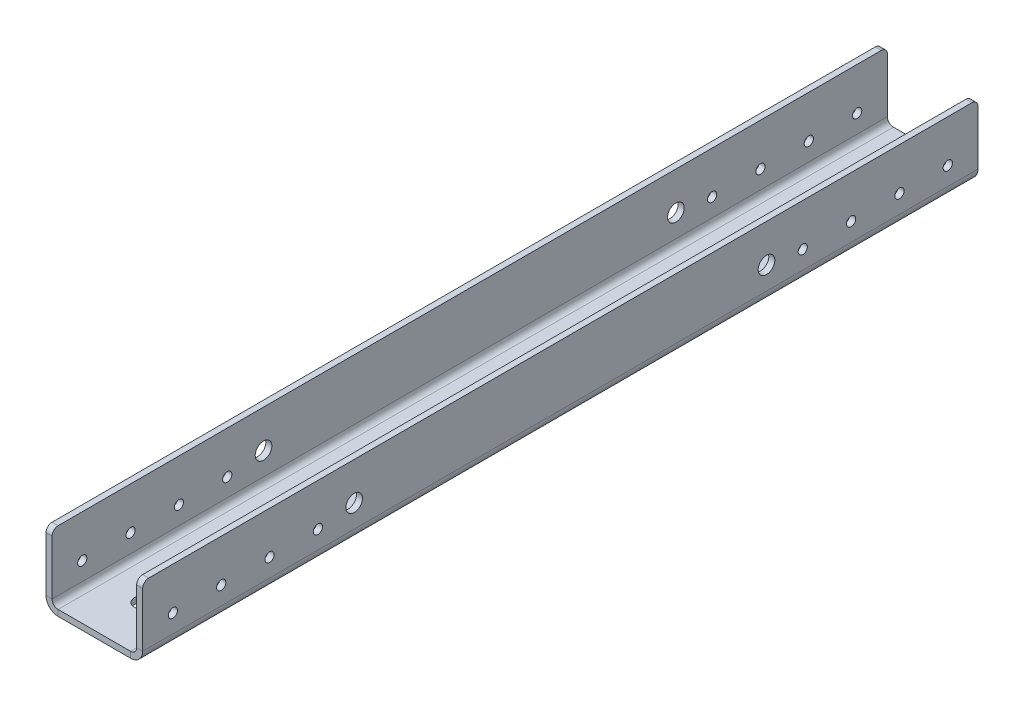
from build123d import *

# Parameters (mm, degrees)
BASE_FLANGE1_DEPTH = 438.912
SKETCH6_R          = 2.4257
CUT_EXTRUDE1_DEPTH = 444.481672388
SKETCH7_R          = 4.3688
CUT_EXTRUDE2_DEPTH = 444.481672388
SKETCH8_R          = 4.3688
CUT_EXTRUDE3_DEPTH = 444.481672388
FILLET1_R          = 3.175


# Sheet-metal steps are written as plain solids
with BuildPart() as part:
    # Sketch1 → Base-Flange1 (new body)
    with BuildSketch(Plane.XY):
        with BuildLine():
            Line((50.8, 38.1), (50.8, 6.35))
            ThreePointArc((50.8, 6.35), (48.940128061, 1.859871939), (44.45, 0))
            Line((44.45, 0), (6.35, 0))
            ThreePointArc((6.35, 0), (1.859871939, 1.859871939), (0, 6.35))
            Line((0, 6.35), (0, 38.1))
            Line((0, 38.1), (3.175, 38.1))
            Line((3.175, 38.1), (3.175, 6.35))
            ThreePointArc((3.175, 6.35), (4.10493597, 4.10493597), (6.35, 3.175))
            Line((6.35, 3.175), (44.45, 3.175))
            ThreePointArc((44.45, 3.175), (46.69506403, 4.10493597), (47.625, 6.35))
            Line((47.625, 6.35), (47.625, 38.1))
            Line((47.625, 38.1), (50.8, 38.1))
        make_face()
    extrude(amount=BASE_FLANGE1_DEPTH)

    # Sketch6 → Cut-Extrude1 (cut, through all)
    with BuildSketch(Plane(origin=(50.8, 0, 0), x_dir=(0, 0, -1), z_dir=(1, 0, 0))):
        with Locations((-15.875, 15.875)):
            Circle(SKETCH6_R)
        with Locations((-41.275, 15.875)):
            Circle(SKETCH6_R)
        with Locations((-66.675, 15.875)):
            Circle(SKETCH6_R)
        with Locations((-372.237, 15.875)):
            Circle(SKETCH6_R)
        with Locations((-397.637, 15.875)):
            Circle(SKETCH6_R)
        with Locations((-423.037, 15.875)):
            Circle(SKETCH6_R)
        with Locations((-92.075, 15.875)):
            Circle(SKETCH6_R)
        with Locations((-346.837, 15.875)):
            Circle(SKETCH6_R)
    extrude(amount=-CUT_EXTRUDE1_DEPTH, mode=Mode.SUBTRACT)

    # Sketch7 → Cut-Extrude2 (cut, through all)
    with BuildSketch(Plane.XZ):
        with Locations(Location((25.4, 219.456, 0), (0, 0, 270))):
            Circle(SKETCH7_R)
        with Locations(Location((25.4, 25.4, 0), (0, 0, 270))):
            Circle(SKETCH7_R)
        with Locations(Location((25.4, 413.512, 0), (0, 0, 270))):
            Circle(SKETCH7_R)
    extrude(amount=-CUT_EXTRUDE2_DEPTH, mode=Mode.SUBTRACT)

    # Sketch8 → Cut-Extrude3 (cut, through all)
    with BuildSketch(Plane(origin=(50.8, 0, 0), x_dir=(0, 0, -1), z_dir=(1, 0, 0))):
        with Locations((-111.125, 18.288)):
            Circle(SKETCH8_R)
        with Locations((-327.787, 18.288)):
            Circle(SKETCH8_R)
    extrude(amount=-CUT_EXTRUDE3_DEPTH, mode=Mode.SUBTRACT)

    # Fillet1
    fillet1_edges = [part.edges().sort_by_distance(p)[0] for p in [
        (1.5875, 38.1, 0),
        (49.2125, 38.1, 0),
        (1.5875, 38.1, 438.912),
        (49.2125, 38.1, 438.912),
    ]]
    fillet(fillet1_edges, radius=FILLET1_R)


solid = part.part
